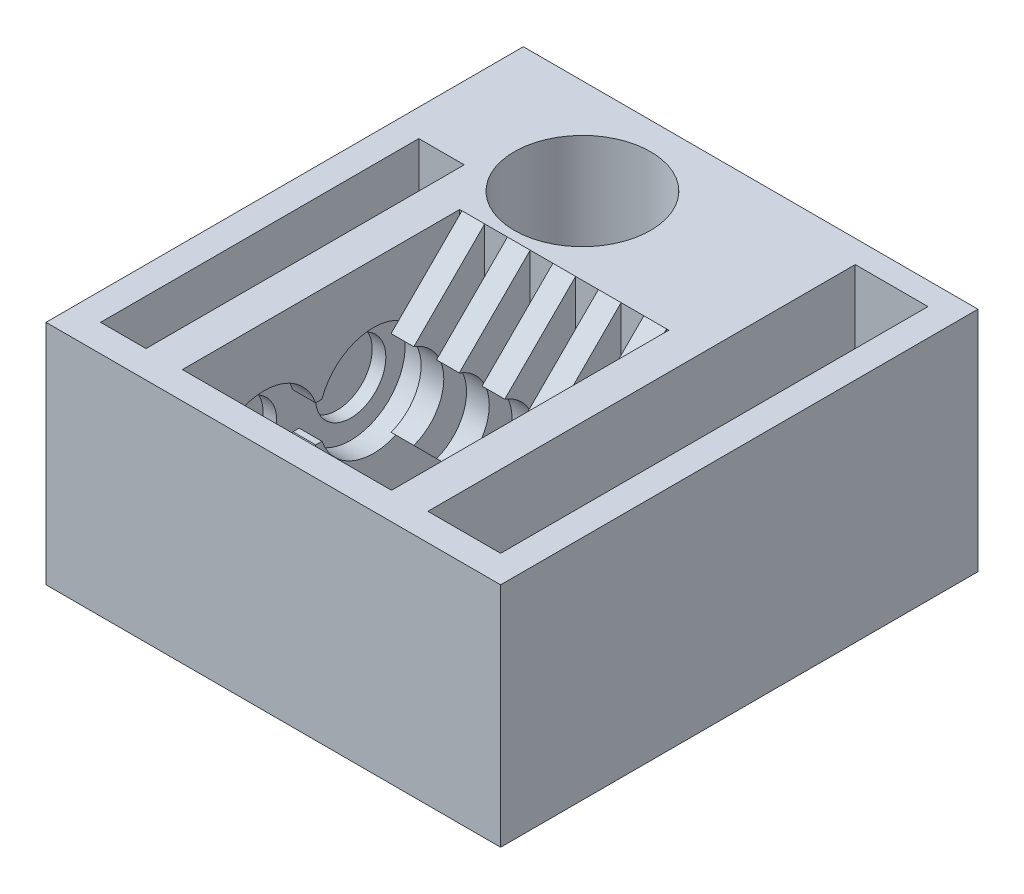
from build123d import *

# Parameters (mm, degrees)
SKETCH2_W           = 100
SKETCH2_H           = 105
BOSS_EXTRUDE1_DEPTH = 50
CUT_EXTRUDE1_REACH  = 90.07
SKETCH3_R           = 15
CUT_EXTRUDE3_REACH  = 90.07
SKETCH5_W           = 16
SKETCH5_H           = 80
SKETCH5_W_2         = 10
SKETCH5_H_2         = 70
CUT_EXTRUDE4_DEPTH  = 31
SKETCH7_R           = 7.75
BOSS_EXTRUDE2_DEPTH = 3
CUT_EXTRUDE7_REACH  = 90.07
SKETCH11_W          = 16
SKETCH11_H          = 14
CUT_EXTRUDE5_REACH  = 90.07
SKETCH8_W           = 46
SKETCH8_H           = 61
SKETCH9_R           = 1.75
CUT_EXTRUDE8_DEPTH  = 3
SKETCH13_W          = 20
SKETCH13_H          = 19
CUT_EXTRUDE9_DEPTH  = 30
BOSS_EXTRUDE4_DEPTH = 5
LPATTERN10_COUNT    = 5
LPATTERN10_PITCH    = 10
BOSS_EXTRUDE5_DEPTH = 5
LPATTERN11_COUNT    = 4
LPATTERN11_PITCH    = 10


with BuildPart() as part:
    # Sketch2 → Boss-Extrude1 (new body)
    with BuildSketch(Plane(origin=(0, 0, 0), x_dir=(1, 0, 0), z_dir=(0, 1, 0))):
        Rectangle(SKETCH2_W, SKETCH2_H)
    extrude(amount=BOSS_EXTRUDE1_DEPTH)

    # Sketch3 → Cut-Extrude1 (cut, up to next)
    with BuildSketch(Plane(origin=(0, 50, 0), x_dir=(1, 0, 0), z_dir=(0, 1, 0)), mode=Mode.PRIVATE) as cut_extrude1_sk1:
        with Locations((-16.005435425, 31.5)):
            Circle(SKETCH3_R)
    cut_extrude1_tool1 = extrude(cut_extrude1_sk1.sketch, amount=-CUT_EXTRUDE1_REACH, mode=Mode.PRIVATE) & part.part
    add(cut_extrude1_tool1.solids().sort_by_distance((-16.005435, 50, -31.5))[0], mode=Mode.SUBTRACT)

    # Sketch5 → Cut-Extrude3 (cut, up to next)
    with BuildSketch(Plane(origin=(0, 50, 0), x_dir=(1, 0, 0), z_dir=(0, 1, 0)), mode=Mode.PRIVATE) as cut_extrude3_sk1:
        with Locations((36, -6.5)):
            Rectangle(SKETCH5_W, SKETCH5_H)
    cut_extrude3_tool1 = extrude(cut_extrude3_sk1.sketch, amount=-CUT_EXTRUDE3_REACH, mode=Mode.PRIVATE) & part.part
    # Sketch5 → Cut-Extrude3 (cut, up to next)
    with BuildSketch(Plane(origin=(0, 50, 0), x_dir=(1, 0, 0), z_dir=(0, 1, 0)), mode=Mode.PRIVATE) as cut_extrude3_sk2:
        with Locations((-39, -11.5)):
            Rectangle(SKETCH5_W_2, SKETCH5_H_2)
    cut_extrude3_tool2 = extrude(cut_extrude3_sk2.sketch, amount=-CUT_EXTRUDE3_REACH, mode=Mode.PRIVATE) & part.part
    add(cut_extrude3_tool1.solids().sort_by_distance((36, 50, 6.5))[0], mode=Mode.SUBTRACT)
    add(cut_extrude3_tool2.solids().sort_by_distance((-39, 50, 11.5))[0], mode=Mode.SUBTRACT)

    # Sketch6 → Cut-Extrude4 (cut)
    with BuildSketch(Plane(origin=(28, 0, 0), x_dir=(0, 0, -1), z_dir=(1, 0, 0))):
        with BuildLine():
            Line((-17.186291501, 29), (-15.813708499, 29))
            ThreePointArc((-15.813708499, 29), (7.5, 25), (-15.813708499, 21))
            Line((-15.813708499, 21), (-17.186291501, 21))
            ThreePointArc((-17.186291501, 21), (-40.5, 25), (-17.186291501, 29))
        make_face()
    cut_extrude4 = extrude(amount=-CUT_EXTRUDE4_DEPTH, mode=Mode.SUBTRACT)

    # Sketch7 → Boss-Extrude2 (add)
    with BuildSketch(Plane(origin=(28, 0, 0), x_dir=(0, 0, -1), z_dir=(1, 0, 0))):
        with BuildLine():
            Line((-17.186291501, 21), (-15.813708499, 21))
            ThreePointArc((-15.813708499, 21), (7.5, 25), (-15.813708499, 29))
            Line((-15.813708499, 29), (-17.186291501, 29))
            ThreePointArc((-17.186291501, 29), (-40.5, 25), (-17.186291501, 21))
        make_face()
        with Locations((-28.5, 25)):
            Circle(SKETCH7_R, mode=Mode.SUBTRACT)
        with Locations((-4.5, 25)):
            Circle(SKETCH7_R, mode=Mode.SUBTRACT)
    boss_extrude2 = extrude(amount=-BOSS_EXTRUDE2_DEPTH)

    # Mirror1: Cut-Extrude4, Boss-Extrude2 across plane
    add(cut_extrude4.mirror(Plane(origin=(-3, 0, 0), x_dir=(0, 0, 1), z_dir=(1, 0, 0))), mode=Mode.SUBTRACT)
    add(boss_extrude2.mirror(Plane(origin=(-3, 0, 0), x_dir=(0, 0, 1), z_dir=(1, 0, 0))))

    # Sketch11 → Cut-Extrude7 (cut, up to next)
    with BuildSketch(Plane(origin=(0, 50, 0), x_dir=(1, 0, 0), z_dir=(0, 1, 0)), mode=Mode.PRIVATE) as cut_extrude7_sk1:
        with Locations((36, 40.5)):
            Rectangle(SKETCH11_W, SKETCH11_H)
    cut_extrude7_tool1 = extrude(cut_extrude7_sk1.sketch, amount=-CUT_EXTRUDE7_REACH, mode=Mode.PRIVATE) & part.part
    add(cut_extrude7_tool1.solids().sort_by_distance((36, 50, -40.5))[0], mode=Mode.SUBTRACT)

    # Sketch8 → Cut-Extrude5 (cut, up to next)
    with BuildSketch(Plane(origin=(0, 50, 0), x_dir=(1, 0, 0), z_dir=(0, 1, 0)), mode=Mode.PRIVATE) as cut_extrude5_sk1:
        with Locations((-3, -16)):
            Rectangle(SKETCH8_W, SKETCH8_H)
    cut_extrude5_tool1 = extrude(cut_extrude5_sk1.sketch, amount=-CUT_EXTRUDE5_REACH, mode=Mode.PRIVATE) & part.part
    add(cut_extrude5_tool1.solids().sort_by_distance((-3, 50, 16))[0], mode=Mode.SUBTRACT)

    # Sketch9 → Cut-Extrude8 (cut)
    with BuildSketch(Plane(origin=(28, 0, 0), x_dir=(0, 0, -1), z_dir=(1, 0, 0))):
        with Locations((19.5, 25)):
            Circle(SKETCH9_R)
    extrude(amount=-CUT_EXTRUDE8_DEPTH, mode=Mode.SUBTRACT)

    # Sketch13 → Cut-Extrude9 (cut)
    with BuildSketch(Plane.XZ):
        with Locations((15, -24)):
            Rectangle(SKETCH13_W, SKETCH13_H)
    extrude(amount=-CUT_EXTRUDE9_DEPTH, mode=Mode.SUBTRACT)


with BuildPart() as body_2:
    # Sketch14 → Boss-Extrude4 (new body)
    with BuildSketch(Plane.ZY.offset(-19.5)):
        with BuildLine():
            Line((-14.5, 50), (-14.5, 0))
            Line((-14.5, 0), (1.096875763, 15.596875763))
            ThreePointArc((1.096875763, 15.596875763), (-5.5, 25), (1.096875763, 34.403124237))
            Line((1.096875763, 34.403124237), (-14.5, 50))
        make_face()
    boss_extrude4 = extrude(amount=BOSS_EXTRUDE4_DEPTH)


with BuildPart() as lpattern10_1:
    # LPattern10: Boss-Extrude4 ×5
    with Locations(*[(-i * LPATTERN10_PITCH, 0, 0) for i in range(1, LPATTERN10_COUNT)]):
        add(boss_extrude4)


with BuildPart() as body_7:
    # Sketch15 → Boss-Extrude5 (new body)
    with BuildSketch(Plane.ZY.offset(-14.5)):
        with BuildLine():
            Line((46.5, 0), (46.5, 50))
            Line((46.5, 50), (31.144102864, 34.644102864))
            ThreePointArc((31.144102864, 34.644102864), (38.5, 25), (31.144102864, 15.355897136))
            Line((31.144102864, 15.355897136), (46.5, 0))
        make_face()
    boss_extrude5 = extrude(amount=BOSS_EXTRUDE5_DEPTH)


with BuildPart() as lpattern11_1:
    # LPattern11: Boss-Extrude5 ×4
    with Locations(*[(-i * LPATTERN11_PITCH, 0, 0) for i in range(1, LPATTERN11_COUNT)]):
        add(boss_extrude5)


solid = Compound([part.part, body_2.part, lpattern10_1.part, body_7.part, lpattern11_1.part])
